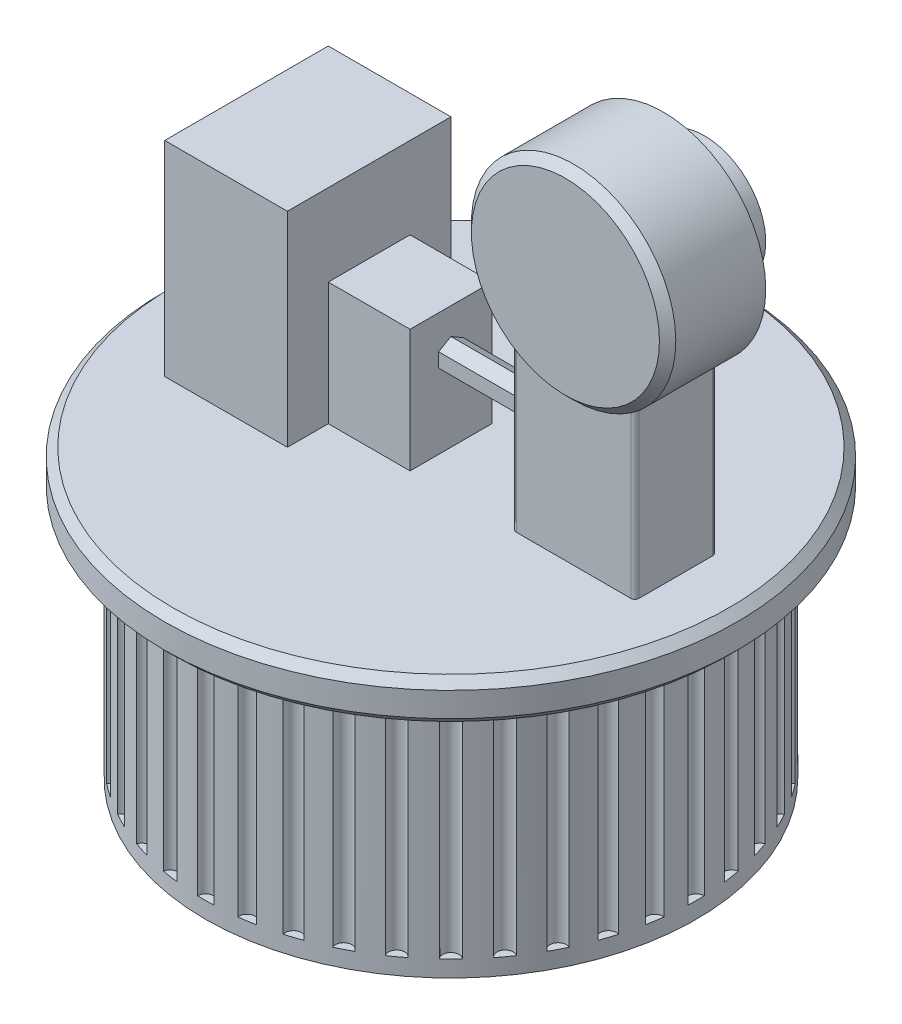
from build123d import *
from build123d.topology import SkipClean

# Parameters (mm, degrees)
SKETCH1_R                = 30
BOSS_EXTRUDE1_DEPTH      = 2
BOSS_EXTRUDE2_DEPTH      = 28
SKETCH3_R                = 35
BOSS_EXTRUDE3_DEPTH      = 5
SKETCH4_W                = 15
SKETCH4_H                = 20
BOSS_EXTRUDE4_DEPTH      = 25
SKETCH4_3_W              = 10
SKETCH4_3_H              = 10
BOSS_EXTRUDE5_DEPTH      = 15
SKETCH4_4_W              = 15
SKETCH4_4_H              = 10
BOSS_EXTRUDE6_DEPTH      = 20
BOSS_EXTRUDE7_DEPTH      = 1
BOSS_EXTRUDE7_DEPTH_BACK = 11
SKETCH5_R                = 12.5
SKETCH6_R                = 7.5
BOSS_EXTRUDE8_DEPTH      = 5
BOSS_EXTRUDE9_REACH      = 93.958
CHAMFER1_SIZE            = 1
FILLET1_R                = 0.5
CHAMFER2_SIZE            = 1


# Some blends are built 0.0001 mm under size
with BuildPart() as part:
    # Sketch1 → Boss-Extrude1 (new body)
    with BuildSketch(Plane(origin=(0, 0, 0), x_dir=(1, 0, 0), z_dir=(0, 1, 0))):
        with Locations(Location((0, 0, 0), (0, 0, 270))):
            Circle(SKETCH1_R)
    extrude(amount=BOSS_EXTRUDE1_DEPTH)

    # Sketch2 → Boss-Extrude2 (add)
    with SkipClean():  # the faces are left unmerged after this step: merging them gives an invalid solid
        with BuildSketch(Plane(origin=(0, 2, 0), x_dir=(-1, 0, 0), z_dir=(0, -1, 0))):
            with BuildLine():
                ThreePointArc((-0.999861101, 29.983333333), (-2.353772872, 29.907520012), (-3.702875558, 29.770601482))
                ThreePointArc((-3.702875558, 29.770601482), (-4.536599486, 28.642961877), (-5.677977862, 29.457776009))
                ThreePointArc((-5.677977862, 29.457776009), (-7.003360916, 29.171097612), (-8.314435132, 28.824818619))
                ThreePointArc((-8.314435132, 28.824818619), (-8.961492837, 27.580638973), (-10.216283964, 28.206870475))
                ThreePointArc((-10.216283964, 28.206870475), (-11.480502971, 27.716385975), (-12.721265719, 27.169273058))
                ThreePointArc((-12.721265719, 27.169273058), (-13.165724492, 25.839189201), (-14.503031249, 26.261418176))
                ThreePointArc((-14.503031249, 26.261418176), (-15.674956941, 25.579204931), (-16.814856525, 24.844729824))
                ThreePointArc((-16.814856525, 24.844729824), (-17.045772316, 23.461492837), (-18.432665771, 23.669322605))
                ThreePointArc((-18.432665771, 23.669322605), (-19.48344145, 22.812178968), (-20.494409757, 21.908426888))
                ThreePointArc((-20.494409757, 21.908426888), (-20.506096654, 20.506096654), (-21.908426888, 20.494409757))
                ThreePointArc((-21.908426888, 20.494409757), (-22.812178968, 19.48344145), (-23.669322605, 18.432665771))
                ThreePointArc((-23.669322605, 18.432665771), (-23.461492837, 17.045772316), (-24.844729824, 16.814856525))
                ThreePointArc((-24.844729824, 16.814856525), (-25.579204931, 15.674956941), (-26.261418176, 14.503031249))
                ThreePointArc((-26.261418176, 14.503031249), (-25.839189201, 13.165724492), (-27.169273058, 12.721265719))
                ThreePointArc((-27.169273058, 12.721265719), (-27.716385975, 11.480502971), (-28.206870475, 10.216283964))
                ThreePointArc((-28.206870475, 10.216283964), (-27.580638973, 8.961492837), (-28.824818619, 8.314435132))
                ThreePointArc((-28.824818619, 8.314435132), (-29.171097612, 7.003360916), (-29.457776009, 5.677977862))
                ThreePointArc((-29.457776009, 5.677977862), (-28.642961877, 4.536599486), (-29.770601482, 3.702875558))
                ThreePointArc((-29.770601482, 3.702875558), (-29.907520012, 2.353772872), (-29.983333333, 0.999861101))
                ThreePointArc((-29.983333333, 0.999861101), (-29, 0), (-29.983333333, -0.999861101))
                ThreePointArc((-29.983333333, -0.999861101), (-29.907520012, -2.353772872), (-29.770601482, -3.702875558))
                ThreePointArc((-29.770601482, -3.702875558), (-28.642961877, -4.536599486), (-29.457776009, -5.677977862))
                ThreePointArc((-29.457776009, -5.677977862), (-29.171097612, -7.003360916), (-28.824818619, -8.314435132))
                ThreePointArc((-28.824818619, -8.314435132), (-27.580638973, -8.961492837), (-28.206870475, -10.216283964))
                ThreePointArc((-28.206870475, -10.216283964), (-27.716385975, -11.480502971), (-27.169273058, -12.721265719))
                ThreePointArc((-27.169273058, -12.721265719), (-25.839189201, -13.165724492), (-26.261418176, -14.503031249))
                ThreePointArc((-26.261418176, -14.503031249), (-25.579204931, -15.674956941), (-24.844729824, -16.814856525))
                ThreePointArc((-24.844729824, -16.814856525), (-23.461492837, -17.045772316), (-23.669322605, -18.432665771))
                ThreePointArc((-23.669322605, -18.432665771), (-22.812178968, -19.48344145), (-21.908426888, -20.494409757))
                ThreePointArc((-21.908426888, -20.494409757), (-20.506096654, -20.506096654), (-20.494409757, -21.908426888))
                ThreePointArc((-20.494409757, -21.908426888), (-19.48344145, -22.812178968), (-18.432665771, -23.669322605))
                ThreePointArc((-18.432665771, -23.669322605), (-17.045772316, -23.461492837), (-16.814856525, -24.844729824))
                ThreePointArc((-16.814856525, -24.844729824), (-15.674956941, -25.579204931), (-14.503031249, -26.261418176))
                ThreePointArc((-14.503031249, -26.261418176), (-13.165724492, -25.839189201), (-12.721265719, -27.169273058))
                ThreePointArc((-12.721265719, -27.169273058), (-11.480502971, -27.716385975), (-10.216283964, -28.206870475))
                ThreePointArc((-10.216283964, -28.206870475), (-8.961492837, -27.580638973), (-8.314435132, -28.824818619))
                ThreePointArc((-8.314435132, -28.824818619), (-7.003360916, -29.171097612), (-5.677977862, -29.457776009))
                ThreePointArc((-5.677977862, -29.457776009), (-4.536599486, -28.642961877), (-3.702875558, -29.770601482))
                ThreePointArc((-3.702875558, -29.770601482), (-2.353772872, -29.907520012), (-0.999861101, -29.983333333))
                ThreePointArc((-0.999861101, -29.983333333), (0, -29), (0.999861101, -29.983333333))
                ThreePointArc((0.999861101, -29.983333333), (2.353772872, -29.907520012), (3.702875558, -29.770601482))
                ThreePointArc((3.702875558, -29.770601482), (4.536599486, -28.642961877), (5.677977862, -29.457776009))
                ThreePointArc((5.677977862, -29.457776009), (7.003360916, -29.171097612), (8.314435132, -28.824818619))
                ThreePointArc((8.314435132, -28.824818619), (8.961492837, -27.580638973), (10.216283964, -28.206870475))
                ThreePointArc((10.216283964, -28.206870475), (11.480502971, -27.716385975), (12.721265719, -27.169273058))
                ThreePointArc((12.721265719, -27.169273058), (13.165724492, -25.839189201), (14.503031249, -26.261418176))
                ThreePointArc((14.503031249, -26.261418176), (15.674956941, -25.579204931), (16.814856525, -24.844729824))
                ThreePointArc((16.814856525, -24.844729824), (17.045772316, -23.461492837), (18.432665771, -23.669322605))
                ThreePointArc((18.432665771, -23.669322605), (19.48344145, -22.812178968), (20.494409757, -21.908426888))
                ThreePointArc((20.494409757, -21.908426888), (20.506096654, -20.506096654), (21.908426888, -20.494409757))
                ThreePointArc((21.908426888, -20.494409757), (22.812178968, -19.48344145), (23.669322605, -18.432665771))
                ThreePointArc((23.669322605, -18.432665771), (23.461492837, -17.045772316), (24.844729824, -16.814856525))
                ThreePointArc((24.844729824, -16.814856525), (25.579204931, -15.674956941), (26.261418176, -14.503031249))
                ThreePointArc((26.261418176, -14.503031249), (25.839189201, -13.165724492), (27.169273058, -12.721265719))
                ThreePointArc((27.169273058, -12.721265719), (27.716385975, -11.480502971), (28.206870475, -10.216283964))
                ThreePointArc((28.206870475, -10.216283964), (27.580638973, -8.961492837), (28.824818619, -8.314435132))
                ThreePointArc((28.824818619, -8.314435132), (29.171097612, -7.003360916), (29.457776009, -5.677977862))
                ThreePointArc((29.457776009, -5.677977862), (28.642961877, -4.536599486), (29.770601482, -3.702875558))
                ThreePointArc((29.770601482, -3.702875558), (29.907520012, -2.353772872), (29.983333333, -0.999861101))
                ThreePointArc((29.983333333, -0.999861101), (29, 0), (29.983333333, 0.999861101))
                ThreePointArc((29.983333333, 0.999861101), (29.907520012, 2.353772872), (29.770601482, 3.702875558))
                ThreePointArc((29.770601482, 3.702875558), (28.642961877, 4.536599486), (29.457776009, 5.677977862))
                ThreePointArc((29.457776009, 5.677977862), (29.171097612, 7.003360916), (28.824818619, 8.314435132))
                ThreePointArc((28.824818619, 8.314435132), (27.580638973, 8.961492837), (28.206870475, 10.216283964))
                ThreePointArc((28.206870475, 10.216283964), (27.716385975, 11.480502971), (27.169273058, 12.721265719))
                ThreePointArc((27.169273058, 12.721265719), (25.839189201, 13.165724492), (26.261418176, 14.503031249))
                ThreePointArc((26.261418176, 14.503031249), (25.579204931, 15.674956941), (24.844729824, 16.814856525))
                ThreePointArc((24.844729824, 16.814856525), (23.461492837, 17.045772316), (23.669322605, 18.432665771))
                ThreePointArc((23.669322605, 18.432665771), (22.812178968, 19.48344145), (21.908426888, 20.494409757))
                ThreePointArc((21.908426888, 20.494409757), (20.506096654, 20.506096654), (20.494409757, 21.908426888))
                ThreePointArc((20.494409757, 21.908426888), (19.48344145, 22.812178968), (18.432665771, 23.669322605))
                ThreePointArc((18.432665771, 23.669322605), (17.045772316, 23.461492837), (16.814856525, 24.844729824))
                ThreePointArc((16.814856525, 24.844729824), (15.674956941, 25.579204931), (14.503031249, 26.261418176))
                ThreePointArc((14.503031249, 26.261418176), (13.165724492, 25.839189201), (12.721265719, 27.169273058))
                ThreePointArc((12.721265719, 27.169273058), (11.480502971, 27.716385975), (10.216283964, 28.206870475))
                ThreePointArc((10.216283964, 28.206870475), (8.961492837, 27.580638973), (8.314435132, 28.824818619))
                ThreePointArc((8.314435132, 28.824818619), (7.003360916, 29.171097612), (5.677977862, 29.457776009))
                ThreePointArc((5.677977862, 29.457776009), (4.536599486, 28.642961877), (3.702875558, 29.770601482))
                ThreePointArc((3.702875558, 29.770601482), (2.353772872, 29.907520012), (0.999861101, 29.983333333))
                ThreePointArc((0.999861101, 29.983333333), (0, 29), (-0.999861101, 29.983333333))
            make_face()
        extrude(amount=-BOSS_EXTRUDE2_DEPTH)

    # Sketch3 → Boss-Extrude3 (add)
    with BuildSketch(Plane(origin=(0, 30, 0), x_dir=(1, 0, 0), z_dir=(0, 1, 0))):
        with Locations(Location((0, 0, 0), (0, 0, 270))):
            Circle(SKETCH3_R)
    extrude(amount=BOSS_EXTRUDE3_DEPTH)

    # Sketch4 → Boss-Extrude4 (add)
    with BuildSketch(Plane(origin=(0, 35, 0), x_dir=(1, 0, 0), z_dir=(0, 1, 0))):
        with Locations((-17.5, 0)):
            Rectangle(SKETCH4_W, SKETCH4_H)
    extrude(amount=BOSS_EXTRUDE4_DEPTH)

    # Sketch4<3> → Boss-Extrude5 (add)
    with BuildSketch(Plane(origin=(0, 35, 0), x_dir=(1, 0, 0), z_dir=(0, 1, 0))):
        with Locations((-5, 0)):
            Rectangle(SKETCH4_3_W, SKETCH4_3_H)
    extrude(amount=BOSS_EXTRUDE5_DEPTH)

    # Sketch4<4> → Boss-Extrude6 (add)
    with BuildSketch(Plane(origin=(0, 35, 0), x_dir=(1, 0, 0), z_dir=(0, 1, 0))):
        with Locations((20, 0)):
            Rectangle(SKETCH4_4_W, SKETCH4_4_H)
    extrude(amount=BOSS_EXTRUDE6_DEPTH)

    # Sketch5 → Boss-Extrude7 (add, two sides: drawn at the far end of the back side and taken through both)
    with BuildSketch(Plane.XY.offset(5).offset(-BOSS_EXTRUDE7_DEPTH_BACK)):
        with Locations((20, 65)):
            Circle(SKETCH5_R)
    extrude(amount=BOSS_EXTRUDE7_DEPTH + BOSS_EXTRUDE7_DEPTH_BACK)

    # Sketch6 → Boss-Extrude8 (add)
    with BuildSketch(Plane(origin=(0, 0, -6), x_dir=(-1, 0, 0), z_dir=(0, 0, -1))):
        with Locations((-20, 65)):
            Circle(SKETCH6_R)
    extrude(amount=BOSS_EXTRUDE8_DEPTH)

    # Sketch7 → Boss-Extrude9 (add, up to next)
    with BuildSketch(Plane(origin=(0, 0, 0), x_dir=(0, 0, -1), z_dir=(1, 0, 0)), mode=Mode.PRIVATE) as boss_extrude9_sk1:
        Polygon((0, 46.732050808), (-1.5, 45.866025404), (-1.5, 44.133974596), (0, 43.267949192), (1.5, 44.133974596), (1.5, 45.866025404), align=None)
    boss_extrude9_tool1 = extrude(boss_extrude9_sk1.sketch, amount=BOSS_EXTRUDE9_REACH, mode=Mode.PRIVATE) - part.part
    add(boss_extrude9_tool1.solids().sort_by_distance((0, 45, 0))[0])

    # Chamfer1
    chamfer1_edges = [part.edges().sort_by_distance(p)[0] for p in [
        (0, 30, -35),
        (0, 35, -35),
    ]]
    chamfer(chamfer1_edges, length=CHAMFER1_SIZE)

    # Fillet1
    # the kernel refuses this fillet: 0.5 mm, written as the material it takes off along each edge
    with BuildSketch(Plane(origin=(12.5, 35, -5), x_dir=(0, 0, 1), z_dir=(0, 1, 0))) as fillet1_piece_1_section:
        with BuildLine():
            CenterArc((FILLET1_R, FILLET1_R), FILLET1_R, 180, 90)
            Line((0, FILLET1_R), (0, 0))
            Line((0, 0), (FILLET1_R, 0))
        make_face()
    fillet1_piece_1 = extrude(amount=21.25, mode=Mode.PRIVATE)
    fillet1_piece_1 = fillet1_piece_1 - Plane(origin=(20, 65, -4.88655171), x_dir=(1, 0, 0), z_dir=(0, 0, 1)) * Cylinder(12.5, 45, mode=Mode.PRIVATE)
    add(fillet1_piece_1, mode=Mode.SUBTRACT)
    with BuildSketch(Plane(origin=(12.5, 35, 5), x_dir=(0, 0, -1), z_dir=(0, 1, 0))) as fillet1_piece_2_section:
        with BuildLine():
            CenterArc((FILLET1_R, -FILLET1_R), FILLET1_R, 90, 90)
            Line((0, -FILLET1_R), (0, 0))
            Line((0, 0), (FILLET1_R, 0))
        make_face()
    fillet1_piece_2 = extrude(amount=21.25, mode=Mode.PRIVATE)
    fillet1_piece_2 = fillet1_piece_2 - Plane(origin=(20, 65, 4.88655171), x_dir=(1, 0, 0), z_dir=(0, 0, 1)) * Cylinder(12.5, 45, mode=Mode.PRIVATE)
    add(fillet1_piece_2, mode=Mode.SUBTRACT)
    with BuildSketch(Plane(origin=(27.5, 35, 5), x_dir=(-1, 0, 0), z_dir=(0, 1, 0))) as fillet1_piece_3_section:
        with BuildLine():
            CenterArc((FILLET1_R, -FILLET1_R), FILLET1_R, 90, 90)
            Line((0, -FILLET1_R), (0, 0))
            Line((0, 0), (FILLET1_R, 0))
        make_face()
    fillet1_piece_3 = extrude(amount=21.25, mode=Mode.PRIVATE)
    fillet1_piece_3 = fillet1_piece_3 - Plane(origin=(20, 65, 4.886551682), x_dir=(1, 0, 0), z_dir=(0, 0, -1)) * Cylinder(12.5, 45, mode=Mode.PRIVATE)
    add(fillet1_piece_3, mode=Mode.SUBTRACT)
    with BuildSketch(Plane(origin=(27.5, 35, -5), x_dir=(0, 0, 1), z_dir=(0, 1, 0))) as fillet1_piece_4_section:
        with BuildLine():
            CenterArc((FILLET1_R, -FILLET1_R), FILLET1_R, 90, 90)
            Line((0, -FILLET1_R), (0, 0))
            Line((0, 0), (FILLET1_R, 0))
        make_face()
    fillet1_piece_4 = extrude(amount=21.25, mode=Mode.PRIVATE)
    fillet1_piece_4 = fillet1_piece_4 - Plane(origin=(20, 65, -4.886551683), x_dir=(1, 0, 0), z_dir=(0, 0, 1)) * Cylinder(12.5, 45, mode=Mode.PRIVATE)
    add(fillet1_piece_4, mode=Mode.SUBTRACT)

    # Chamfer2
    chamfer2_edges = [part.edges().sort_by_distance(p)[0] for p in [
        (7.5, 65, 6),
    ]]
    chamfer(chamfer2_edges, length=CHAMFER2_SIZE - 0.0001)  # a hair under: the kernel refuses the full size


solid = part.part
